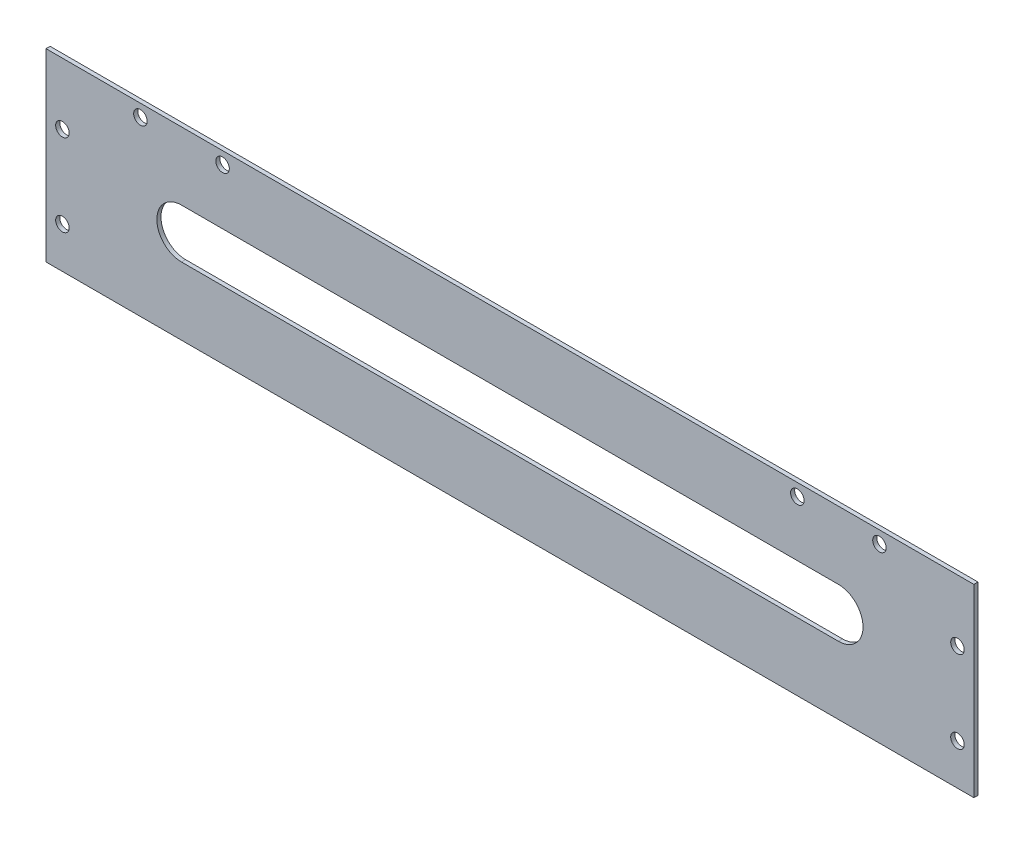
from build123d import *

# Parameters (mm, degrees)
SKETCH_1_W          = 226
SKETCH_1_H          = 45
EXTRUDE_1_DEPTH     = 1
SKETCH_2_R          = 1.65
CUT_EXTRUDE_1_DEPTH = 116.222610628
CUT_EXTRUDE_2_DEPTH = 10
SKETCH_4_R          = 1.65
CUT_EXTRUDE_3_DEPTH = 116.222610628


with BuildPart() as part:
    # 草图1 → 凸台-拉伸1 (new body)
    with BuildSketch(Plane.XY):
        Rectangle(SKETCH_1_W, SKETCH_1_H)
    extrude(amount=EXTRUDE_1_DEPTH)

    # 草图2 → 切除-拉伸1 (cut, through all)
    with BuildSketch(Plane.XY.offset(1)):
        with Locations((90, 19.5)):
            Circle(SKETCH_2_R)
        with Locations((70, 19.5)):
            Circle(SKETCH_2_R)
        with Locations((-70, 19.5)):
            Circle(SKETCH_2_R)
        with Locations((-90, 19.5)):
            Circle(SKETCH_2_R)
    extrude(amount=-CUT_EXTRUDE_1_DEPTH, mode=Mode.SUBTRACT)

    # 草图3 → 切除-拉伸2 (cut)
    with BuildSketch(Plane.XY.offset(1)):
        with BuildLine():
            Line((-80, 6), (80, 6))
            ThreePointArc((80, 6), (86, 0), (80, -6))
            Line((80, -6), (-80, -6))
            ThreePointArc((-80, -6), (-86, 0), (-80, 6))
        make_face()
    extrude(amount=-CUT_EXTRUDE_2_DEPTH, mode=Mode.SUBTRACT)

    # 草图4 → 切除-拉伸3 (cut, through all)
    with BuildSketch(Plane.XY.offset(1)):
        with Locations((109, 7.5)):
            Circle(SKETCH_4_R)
        with Locations((109, -12.5)):
            Circle(SKETCH_4_R)
        with Locations((-109, -12.5)):
            Circle(SKETCH_4_R)
        with Locations((-109, 7.5)):
            Circle(SKETCH_4_R)
    extrude(amount=-CUT_EXTRUDE_3_DEPTH, mode=Mode.SUBTRACT)


solid = part.part
